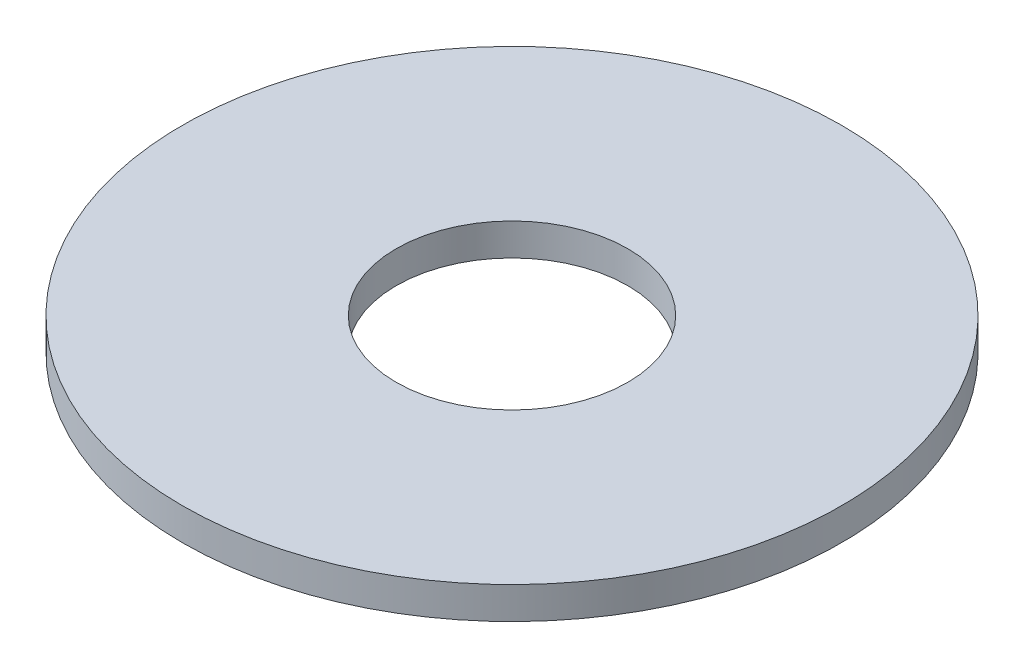
from build123d import *

# Parameters (mm, degrees)
SKETCH1_R           = 92.5
BOSS_EXTRUDE1_DEPTH = 9
SKETCH2_R           = 32.5
CUT_EXTRUDE1_DEPTH  = 132.123987127


with BuildPart() as part:
    # Sketch1 → Boss-Extrude1 (new body)
    with BuildSketch(Plane(origin=(0, 0, 0), x_dir=(1, 0, 0), z_dir=(0, 1, 0))):
        Circle(SKETCH1_R)
    extrude(amount=BOSS_EXTRUDE1_DEPTH)

    # Sketch2 → Cut-Extrude1 (cut, through all)
    with BuildSketch(Plane(origin=(0, 0, 0), x_dir=(1, 0, 0), z_dir=(0, 1, 0))):
        Circle(SKETCH2_R)
    extrude(amount=CUT_EXTRUDE1_DEPTH, mode=Mode.SUBTRACT)


solid = part.part
